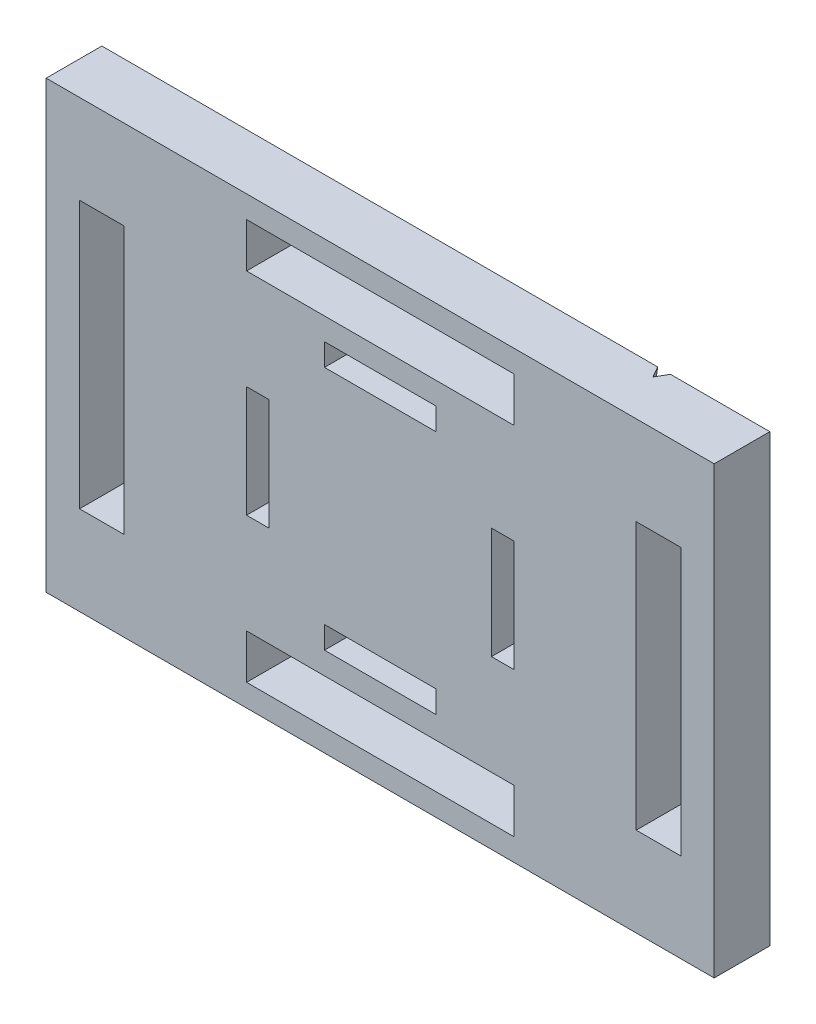
from build123d import *

# Parameters (mm, degrees)
SKETCH_1_W          = 60
SKETCH_1_H          = 40
EXTRUDE_1_DEPTH     = 5
SKETCH_2_W          = 2
SKETCH_2_H          = 10
SKETCH_2_W_2        = 10
SKETCH_2_H_2        = 2
SKETCH_2_W_3        = 4
SKETCH_2_H_3        = 24
SKETCH_2_W_4        = 24
SKETCH_2_H_4        = 4
CUT_EXTRUDE_1_DEPTH = 73.284161474
SWEEP_START         = -34
SWEEP_2_DEPTH       = 43
SWEEP_2_2_DEPTH     = 48


with BuildPart() as part:
    # 草图1 → 凸台-拉伸1 (new body)
    with BuildSketch(Plane.XY):
        with Locations((30, 20)):
            Rectangle(SKETCH_1_W, SKETCH_1_H)
    extrude(amount=EXTRUDE_1_DEPTH)

    # 草图2 → 切除-拉伸1 (cut, through all)
    with BuildSketch(Plane.XY.offset(5)):
        with Locations((19, 20)):
            Rectangle(SKETCH_2_W, SKETCH_2_H)
        with Locations((41, 20)):
            Rectangle(SKETCH_2_W, SKETCH_2_H)
        with Locations((30, 31)):
            Rectangle(SKETCH_2_W_2, SKETCH_2_H_2)
        with Locations((30, 9)):
            Rectangle(SKETCH_2_W_2, SKETCH_2_H_2)
        with Locations((5, 20)):
            Rectangle(SKETCH_2_W_3, SKETCH_2_H_3)
        with Locations((55, 20)):
            Rectangle(SKETCH_2_W_3, SKETCH_2_H_3)
        with Locations((30, 36)):
            Rectangle(SKETCH_2_W_4, SKETCH_2_H_4)
        with Locations((30, 4)):
            Rectangle(SKETCH_2_W_4, SKETCH_2_H_4)
    extrude(amount=-CUT_EXTRUDE_1_DEPTH, mode=Mode.SUBTRACT)

    # 切除-扫描2: read off the stored shape, not the designer's step
    # 切除-扫描2 outline → 切除-扫描2 (cut)
    with BuildSketch(Plane(origin=(0, 0, 0), x_dir=(0.9906788398452959, 0.13621834047872788, 0), z_dir=(0.13621834047872786, -0.9906788398452959, 0)).offset(SWEEP_START)):
        Polygon((56.049983726, 0), (55.478015031, 1), (54.906046336, 0), align=None)
    extrude(amount=SWEEP_2_DEPTH, mode=Mode.SUBTRACT)

    # Sweep 2 2 outline → Sweep 2 2 (cut)
    with BuildSketch(Plane(origin=(0, 0, 0), x_dir=(0.9906788398452959, -0.13621834047872777, 0), z_dir=(0.13621834047872777, 0.9906788398452959, 0))):
        Polygon((45.152516488, 0), (44.008579098, 0), (44.580547793, -1), align=None)
    extrude(amount=SWEEP_2_2_DEPTH, mode=Mode.SUBTRACT)


solid = part.part
